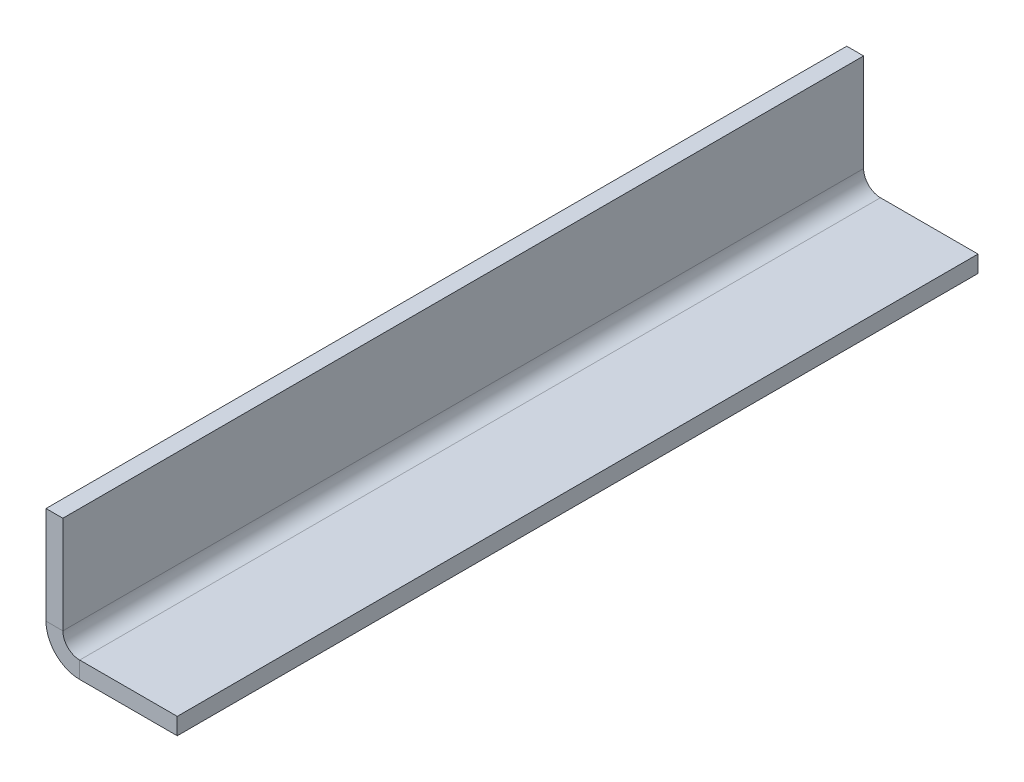
from build123d import *

# Parameters (mm, degrees)
SKETCH1_W                    = 35
SKETCH1_H                    = 5
BASE_FLANGE1_DEPTH           = 0.7366
EDGE_FLANGE1_STRIP_W         = 14.4196
EDGE_FLANGE1_STRIP_H         = 0.7366
EDGE_FLANGE1_STRIP_CUT_DEPTH = 35
EDGE_FLANGE1_DEPTH           = 35


# Sheet-metal steps are written as plain solids
with BuildPart() as part:
    # Sketch1 → Base-Flange1 (new body)
    with BuildSketch(Plane(origin=(0, 0, 0), x_dir=(0, 0, -1), z_dir=(1, 0, 0))):
        Rectangle(SKETCH1_W, SKETCH1_H)
    extrude(amount=-BASE_FLANGE1_DEPTH)

    # Edge-Flange1 strip (across the edge) → Edge-Flange1 strip cut (cut)
    with BuildSketch(Plane(origin=(0, -2.5, 17.5), x_dir=(0, 1, 0), z_dir=(0, 0, -1))):
        with Locations((-6.4732, -0.3683)):
            Rectangle(EDGE_FLANGE1_STRIP_W, EDGE_FLANGE1_STRIP_H)
    extrude(amount=EDGE_FLANGE1_STRIP_CUT_DEPTH, mode=Mode.SUBTRACT)

    # Edge-Flange1 section (across the edge) → Edge-Flange1 (add)
    with BuildSketch(Plane(origin=(0, -2.5, 17.5), x_dir=(0, 1, 0), z_dir=(0, 0, -1))):
        with BuildLine():
            Line((-0.7366, 0.7366), (-0.7366, 5))
            Line((-0.7366, 5), (0, 5))
            Line((0, 5), (0, 0.7366))
            ThreePointArc((0, 0.7366), (0.215745145, 0.215745145), (0.7366, 0))
            Line((0.7366, 0), (0.7366, -0.7366))
            ThreePointArc((0.7366, -0.7366), (-0.30510971, -0.30510971), (-0.7366, 0.7366))
        make_face()
    extrude(amount=EDGE_FLANGE1_DEPTH)


solid = part.part
